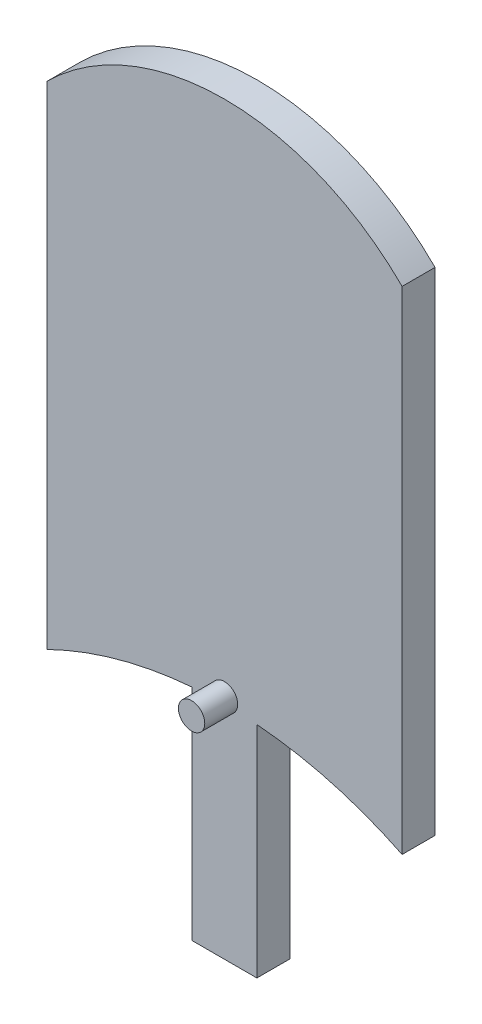
from build123d import *
from build123d.topology import SkipClean

# Parameters (mm, degrees)
BOSS_EXTRUDE1_DEPTH = 3.175
BOSS_EXTRUDE2_START = 3.175
BOSS_EXTRUDE2_DEPTH = 3.175
SKETCH3_W           = 6.236959702
SKETCH3_H           = 41.352711554
BOSS_EXTRUDE3_DEPTH = 3.175
BOSS_EXTRUDE4_DEPTH = 3.175
BOSS_EXTRUDE5_REACH = 47.548
SKETCH6_W           = 0.889
SKETCH6_H           = 43.066281197
CUT_EXTRUDE1_REACH  = 47.451


with BuildPart() as part:
    # Sketch1 → Boss-Extrude1 (new body)
    with BuildSketch(Plane.XY):
        with BuildLine():
            Line((-17.114253333, 23.707583903), (-17.114253333, -23.707583903))
            ThreePointArc((-17.114253333, -23.707583903), (0, -19.732802645), (17.114253333, -23.707583903))
            Line((17.114253333, -23.707583903), (17.114253333, 23.707583903))
            ThreePointArc((17.114253333, 23.707583903), (0, 30.782200079), (-17.114253333, 23.707583903))
        make_face()
    extrude(amount=BOSS_EXTRUDE1_DEPTH)

    # Sketch2 → Boss-Extrude2 (add)
    with SkipClean():  # the faces are left unmerged after this step: merging them gives an invalid solid
        with BuildSketch(Plane(origin=(0, 0, 0), x_dir=(-1, 0, 0), z_dir=(0, 0, -1)).offset(BOSS_EXTRUDE2_START)):
            with BuildLine():
                Line((1.65128862, 23.29835294), (1.65128862, -19.767928257))
                ThreePointArc((1.65128862, -19.767928257), (2.25262846, -19.798194915), (2.853426735, -19.837781624))
                Line((2.853426735, -19.837781624), (2.853426735, 23.29835294))
                Line((2.853426735, 23.29835294), (1.65128862, 23.29835294))
            make_face()
            with BuildLine():
                Line((-1.65128862, -19.767928257), (-1.65128862, 23.29835294))
                Line((-1.65128862, 23.29835294), (-2.853426735, 23.29835294))
                Line((-2.853426735, 23.29835294), (-2.853426735, -19.837781624))
                ThreePointArc((-2.853426735, -19.837781624), (-2.25262846, -19.798194915), (-1.65128862, -19.767928257))
            make_face()
        extrude(amount=-BOSS_EXTRUDE2_DEPTH)

    # Sketch3 → Boss-Extrude3 (add)
    with BuildSketch(Plane.XY.offset(3.175)):
        with Locations((0, -20.33746726)):
            Rectangle(SKETCH3_W, SKETCH3_H)
    extrude(amount=-BOSS_EXTRUDE3_DEPTH)

    # Sketch4 → Boss-Extrude4 (add)
    with BuildSketch(Plane.XY.offset(3.175)):
        with BuildLine():
            ThreePointArc((0, -20.375823038), (0.898025612, -20.003848651), (1.27, -19.105823038))
            ThreePointArc((1.27, -19.105823038), (-0.898025612, -18.207797426), (0, -20.375823038))
        make_face()
    extrude(amount=BOSS_EXTRUDE4_DEPTH)

    # Sketch6 → Boss-Extrude5 (add, up to next)
    with BuildSketch(Plane.ZY.offset(-1.65128862), mode=Mode.PRIVATE) as boss_extrude5_sk1:
        with Locations((-2.7305, 1.765212341)):
            Rectangle(SKETCH6_W, SKETCH6_H)
    boss_extrude5_tool1 = extrude(boss_extrude5_sk1.sketch, amount=BOSS_EXTRUDE5_REACH, mode=Mode.PRIVATE) - part.part
    add(boss_extrude5_tool1.solids().sort_by_distance((1.651289, 1.765212, -2.7305))[0])

    # Sketch8 → Cut-Extrude1 (cut, up to next)
    with BuildSketch(Plane(origin=(0, 0, -3.175), x_dir=(-1, 0, 0), z_dir=(0, 0, -1)), mode=Mode.PRIVATE) as cut_extrude1_sk1:
        Polygon((0, 23.29835294), (-1.016, 23.29835294), (-1.016, -19.767928257), (1.016, -19.767928257), (1.016, 23.29835294), align=None)
    cut_extrude1_tool1 = extrude(cut_extrude1_sk1.sketch, amount=-CUT_EXTRUDE1_REACH, mode=Mode.PRIVATE) & part.part
    add(cut_extrude1_tool1.solids().sort_by_distance((0, 1.765212, -3.175))[0], mode=Mode.SUBTRACT)


solid = part.part
